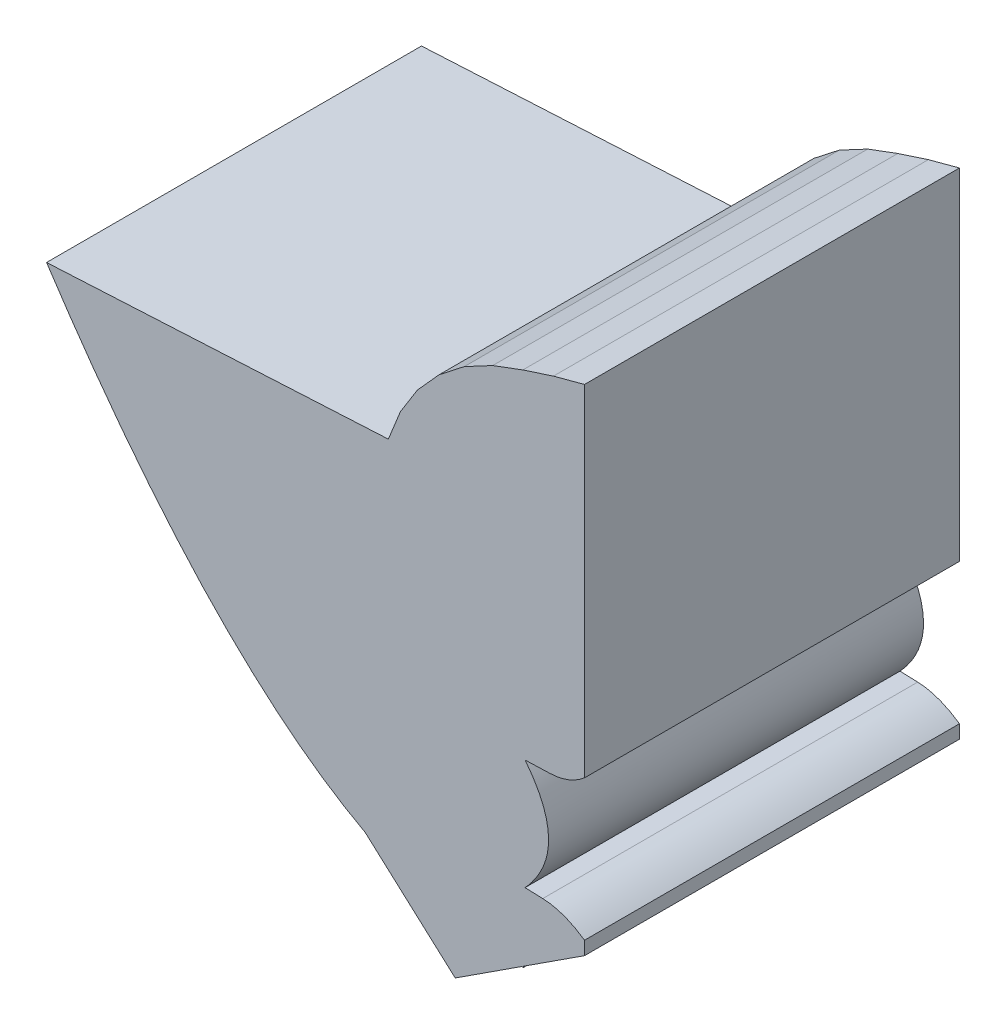
from build123d import *

# Parameters (mm, degrees)
CROQUIS_BASE_DEPTH              = 6.9937
LENTE_PPAL_1_REACH              = 29.176
LENTE_PPAL_1_DIRECTION_2_REACH  = 29.176
LENTE_PPAL_2_DEPTH              = 28.175928622
LENTE_PPAL_2_DEPTH_BACK         = 28.175928622
CROQUIS9_3_OUTSIDE_W            = 30.065
CROQUIS9_3_OUTSIDE_H            = 25.937
LENTE_FRONTAL_REACH             = 25.403
LENTE_FRONTAL_DIRECTION_2_REACH = 25.403
LENTE_TRASERA_REACH             = 28.281
LENTE_TRASERA_DIRECTION_2_REACH = 28.281


with BuildPart() as part:
    # Croquis1 → croquis base (new, symmetric)
    with BuildSketch(Plane.XY):
        with BuildLine():
            Line((-6.994875026, 10.477389992), (-8.981845695, 12.608155172))
            Line((-8.981845695, 12.608155172), (-23.035921146, 11.871612288))
            Line((-23.035921146, 11.871612288), (-23.035921146, 11.54013782))
            ThreePointArc((-23.035921146, 11.54013782), (-20.949684518, 9.582335705), (-18.945192114, 7.540918896))
            add(Edge.make_bspline(
                [(-18.945192114, 7.540918896), (-10.215008384, -3.697644103), (-2.846604825, -5.059081104)],
                knots=[0.497667241, 0.497667241, 0.497667241, 0.49955428, 0.49955428, 0.49955428], degree=2))
            add(Edge.make_bspline(
                [(-2.846604825, -5.059081104), (-2.498165198, -4.87297933), (-2.177330417, -4.684462446)],
                knots=[0.498812075, 0.498812075, 0.498812075, 0.498911556, 0.498911556, 0.498911556], degree=2))
            Line((-2.177330418, -4.684462446), (-2.177330418, 6.186438919))
            add(Edge.make_bspline(
                [(-2.177330418, 6.186438919), (-4.063319702, 8.141636997), (-6.994875026, 10.477389992)],
                knots=[0.50138293, 0.50138293, 0.50138293, 0.502013312, 0.502013312, 0.502013312], degree=2))
        make_face()
    extrude(amount=CROQUIS_BASE_DEPTH, both=True)

    # lente ppal 1: up to this face of the body (flat: up to its plane)
    lente_ppal_1_end = Plane(part.part.faces().sort_by_distance((-10.153546236, 5.159655324, 6.9937))[0])
    # Croquis9 → lente ppal 1 (add, up to the picked face)
    with BuildSketch(Plane.XY, mode=Mode.PRIVATE) as lente_ppal_1_sk1:
        with BuildLine():
            Line((-2.177330418, -4.388282022), (-2.177330418, -1.840420572))
            add(Edge.make_bspline(
                [(-2.177330418, 2.424232079), (-0.304369248, 0.128042884), (-2.177330418, -1.840420572)],
                knots=[0, 0, 0, 1, 1, 1], degree=2))
            Line((-2.177330418, 2.424232079), (-2.177330418, 6.082860828))
            Line((-2.177330418, 6.082860828), (-10.309820395, 10))
            Line((-10.309820395, 10), (-19.969359014, 9.493765032))
            add(Edge.make_bspline(
                [(-2.177330418, -4.388282022), (-10.4130765, -4.994158739), (-19.969359014, 9.493765032)],
                knots=[0, 0, 0, 1, 1, 1], degree=2))
        make_face()
    lente_ppal_1_tool1 = split(extrude(lente_ppal_1_sk1.sketch, amount=LENTE_PPAL_1_REACH, mode=Mode.PRIVATE), bisect_by=lente_ppal_1_end, keep=Keep.BOTH, mode=Mode.PRIVATE)
    add(lente_ppal_1_tool1.solids().sort_by(Axis((-9.106368, 3.599172, 0), (0, 0, 1)))[0])

    # lente ppal 1 direction 2: up to this face of the body (flat: up to its plane)
    lente_ppal_1_direction_2_end = Plane(part.part.faces().sort_by_distance((-10.153546236, 5.159655324, -6.9937))[0])
    # Croquis9 → lente ppal 1 direction 2 (add, up to the picked face)
    with BuildSketch(Plane.XY, mode=Mode.PRIVATE) as lente_ppal_1_direction_2_sk1:
        with BuildLine():
            Line((-2.177330418, -4.388282022), (-2.177330418, -1.840420572))
            add(Edge.make_bspline(
                [(-2.177330418, 2.424232079), (-0.304369248, 0.128042884), (-2.177330418, -1.840420572)],
                knots=[0, 0, 0, 1, 1, 1], degree=2))
            Line((-2.177330418, 2.424232079), (-2.177330418, 6.082860828))
            Line((-2.177330418, 6.082860828), (-10.309820395, 10))
            Line((-10.309820395, 10), (-19.969359014, 9.493765032))
            add(Edge.make_bspline(
                [(-2.177330418, -4.388282022), (-10.4130765, -4.994158739), (-19.969359014, 9.493765032)],
                knots=[0, 0, 0, 1, 1, 1], degree=2))
        make_face()
    lente_ppal_1_direction_2_tool1 = split(extrude(lente_ppal_1_direction_2_sk1.sketch, amount=-LENTE_PPAL_1_DIRECTION_2_REACH, mode=Mode.PRIVATE), bisect_by=lente_ppal_1_direction_2_end, keep=Keep.BOTH, mode=Mode.PRIVATE)
    add(lente_ppal_1_direction_2_tool1.solids().sort_by(Axis((-9.106368, 3.599172, 0), (0, 0, -1)))[0])

    # Croquis9<3> outside → lente ppal 2 (cut, two sides: drawn at the far end of the back side and taken through both)
    with BuildSketch(Plane.XY.offset(-LENTE_PPAL_2_DEPTH_BACK)):
        with Locations((-12.1385, 3.7745)):
            Rectangle(CROQUIS9_3_OUTSIDE_W, CROQUIS9_3_OUTSIDE_H)
        with BuildLine():
            Line((-2.177330418, -1.840420572), (-2.177330418, -4.388282022))
            add(Edge.make_bspline(
                [(-2.177330418, -4.388282022), (-10.4130765, -4.994158739), (-19.969359014, 9.493765032)],
                knots=[0, 0, 0, 1, 1, 1], degree=2))
            Line((-19.969359014, 9.493765032), (-10.309820395, 10))
            Line((-10.309820395, 10), (-2.177330418, 6.082860828))
            Line((-2.177330418, 6.082860828), (-2.177330418, 2.424232079))
            add(Edge.make_bspline(
                [(-2.177330418, 2.424232079), (-0.304369248, 0.128042884), (-2.177330418, -1.840420572)],
                knots=[0, 0, 0, 1, 1, 1], degree=2))
        make_face(mode=Mode.SUBTRACT)
    extrude(amount=LENTE_PPAL_2_DEPTH + LENTE_PPAL_2_DEPTH_BACK, mode=Mode.SUBTRACT)

    # lente frontal: up to this face of the body (flat: up to its plane)
    lente_frontal_end = Plane(part.part.faces().sort_by_distance((-9.106367081, 3.599171888, 6.9937))[0])
    # Croquis8 → lente frontal (add, up to the picked face)
    with BuildSketch(Plane.XY, mode=Mode.PRIVATE) as lente_frontal_sk1:
        with BuildLine():
            Line((0.1, 2.877673418), (0.1, 15.587903347))
            Line((0.1, 15.587903347), (-1.059110992, 15.277320493))
            Line((-1.059110992, 15.277320493), (-2.200378811, 14.9065001))
            Line((-2.200378811, 14.9065001), (-3.324385438, 14.486251242))
            Line((-3.324385438, 14.486251242), (-4.38392255, 13.922885367))
            Line((-4.38392255, 13.922885367), (-5.329535454, 13.184091597))
            Line((-5.329535454, 13.184091597), (-6.132492182, 12.292317806))
            Line((-6.132492182, 12.292317806), (-6.768395299, 11.274660091))
            Line((-6.768395299, 11.274660091), (-7.217923211, 10.162039465))
            Line((-7.217923211, 10.162039465), (-10.309820395, 10))
            Line((-10.309820395, 10), (-2.177330418, 2.342487007))
            Line((-2.177330418, 2.342487007), (-1.190501641, 2.376947827))
            add(Edge.make_bspline(
                [(-1.190501641, 2.376947827), (-0.463368169, 2.402339888), (0.1, 2.877673418)],
                knots=[0, 0, 0, 1, 1, 1], degree=2))
        make_face()
    lente_frontal_tool1 = split(extrude(lente_frontal_sk1.sketch, amount=LENTE_FRONTAL_REACH, mode=Mode.PRIVATE), bisect_by=lente_frontal_end, keep=Keep.BOTH, mode=Mode.PRIVATE)
    add(lente_frontal_tool1.solids().sort_by(Axis((-3.290182, 8.96302, 0), (0, 0, 1)))[0])

    # lente frontal direction 2: up to this face of the body (flat: up to its plane)
    lente_frontal_direction_2_end = Plane(part.part.faces().sort_by_distance((-9.106367081, 3.599171888, -6.9937))[0])
    # Croquis8 → lente frontal direction 2 (add, up to the picked face)
    with BuildSketch(Plane.XY, mode=Mode.PRIVATE) as lente_frontal_direction_2_sk1:
        with BuildLine():
            Line((0.1, 2.877673418), (0.1, 15.587903347))
            Line((0.1, 15.587903347), (-1.059110992, 15.277320493))
            Line((-1.059110992, 15.277320493), (-2.200378811, 14.9065001))
            Line((-2.200378811, 14.9065001), (-3.324385438, 14.486251242))
            Line((-3.324385438, 14.486251242), (-4.38392255, 13.922885367))
            Line((-4.38392255, 13.922885367), (-5.329535454, 13.184091597))
            Line((-5.329535454, 13.184091597), (-6.132492182, 12.292317806))
            Line((-6.132492182, 12.292317806), (-6.768395299, 11.274660091))
            Line((-6.768395299, 11.274660091), (-7.217923211, 10.162039465))
            Line((-7.217923211, 10.162039465), (-10.309820395, 10))
            Line((-10.309820395, 10), (-2.177330418, 2.342487007))
            Line((-2.177330418, 2.342487007), (-1.190501641, 2.376947827))
            add(Edge.make_bspline(
                [(-1.190501641, 2.376947827), (-0.463368169, 2.402339888), (0.1, 2.877673418)],
                knots=[0, 0, 0, 1, 1, 1], degree=2))
        make_face()
    lente_frontal_direction_2_tool1 = split(extrude(lente_frontal_direction_2_sk1.sketch, amount=-LENTE_FRONTAL_DIRECTION_2_REACH, mode=Mode.PRIVATE), bisect_by=lente_frontal_direction_2_end, keep=Keep.BOTH, mode=Mode.PRIVATE)
    add(lente_frontal_direction_2_tool1.solids().sort_by(Axis((-3.290182, 8.96302, 0), (0, 0, -1)))[0])

    # lente trasera: up to this face of the body (flat: up to its plane)
    lente_trasera_end = Plane(part.part.faces().sort_by_distance((-7.357064552, 5.305385386, 6.9937))[0])
    # Croquis11 → lente trasera (add, up to the picked face)
    with BuildSketch(Plane.XY, mode=Mode.PRIVATE) as lente_trasera_sk1:
        with BuildLine():
            Line((0.1, -2.367807069), (0.1, -2.867807069))
            Line((0.1, -2.867807069), (-4.723154154, -6))
            Line((-4.723154154, -6), (-9.706405629, -1.513060218))
            Line((-9.706405629, -1.513060218), (-1.458120605, -1.801096678))
            add(Edge.make_bspline(
                [(-1.458120605, -1.801096678), (-0.674591915, -1.828458103), (0.1, -2.367807069)],
                knots=[0, 0, 0, 1, 1, 1], degree=2))
        make_face()
    lente_trasera_tool1 = split(extrude(lente_trasera_sk1.sketch, amount=LENTE_TRASERA_REACH, mode=Mode.PRIVATE), bisect_by=lente_trasera_end, keep=Keep.BOTH, mode=Mode.PRIVATE)
    add(lente_trasera_tool1.solids().sort_by(Axis((-4.485422, -3.182948, 0), (0, 0, 1)))[0])

    # lente trasera direction 2: up to this face of the body (flat: up to its plane)
    lente_trasera_direction_2_end = Plane(part.part.faces().sort_by_distance((-7.357064552, 5.305385386, -6.9937))[0])
    # Croquis11 → lente trasera direction 2 (add, up to the picked face)
    with BuildSketch(Plane.XY, mode=Mode.PRIVATE) as lente_trasera_direction_2_sk1:
        with BuildLine():
            Line((0.1, -2.367807069), (0.1, -2.867807069))
            Line((0.1, -2.867807069), (-4.723154154, -6))
            Line((-4.723154154, -6), (-9.706405629, -1.513060218))
            Line((-9.706405629, -1.513060218), (-1.458120605, -1.801096678))
            add(Edge.make_bspline(
                [(-1.458120605, -1.801096678), (-0.674591915, -1.828458103), (0.1, -2.367807069)],
                knots=[0, 0, 0, 1, 1, 1], degree=2))
        make_face()
    lente_trasera_direction_2_tool1 = split(extrude(lente_trasera_direction_2_sk1.sketch, amount=-LENTE_TRASERA_DIRECTION_2_REACH, mode=Mode.PRIVATE), bisect_by=lente_trasera_direction_2_end, keep=Keep.BOTH, mode=Mode.PRIVATE)
    add(lente_trasera_direction_2_tool1.solids().sort_by(Axis((-4.485422, -3.182948, 0), (0, 0, -1)))[0])


solid = part.part
